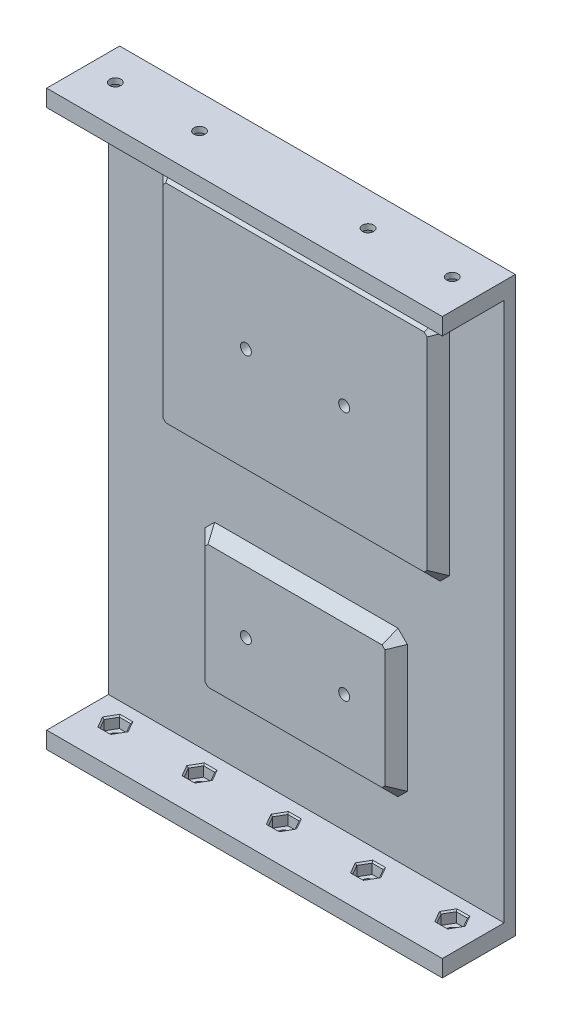
from build123d import *

# Parameters (mm, degrees)
SKETCH1_W               = 140.9
SKETCH1_H               = 204
BOSS_EXTRUDE1_DEPTH     = 4
SKETCH4_W               = 140.9
SKETCH4_H               = 6
BOSS_EXTRUDE3_DEPTH     = 22
CUT_EXTRUDE1_DEPTH      = 217.940550612
CUT_EXTRUDE1_DEPTH_BACK = 217.940550612
SKETCH5_R               = 2
CUT_EXTRUDE4_DEPTH      = 4
SKETCH9_R               = 2
CUT_EXTRUDE5_DEPTH      = 212.308311479
CUT_EXTRUDE6_DEPTH      = 4
CHAMFER1_SIZE           = 0.5
SKETCH11_W              = 64
SKETCH11_H              = 44
SKETCH11_W_2            = 94
SKETCH11_H_2            = 74
BOSS_EXTRUDE4_DEPTH     = 4
CHAMFER2_SIZE           = 1
CHAMFER3_SIZE           = 4
SKETCH12_R              = 1.95
CUT_EXTRUDE7_DEPTH      = 5


with BuildPart() as part:
    # Sketch1 → Boss-Extrude1 (new body)
    with BuildSketch(Plane.XY):
        Rectangle(SKETCH1_W, SKETCH1_H)
    extrude(amount=-BOSS_EXTRUDE1_DEPTH)

    # Sketch4 → Boss-Extrude3 (add)
    with BuildSketch(Plane.XY):
        with Locations((0, 99)):
            Rectangle(SKETCH4_W, SKETCH4_H)
        with Locations((0, -99)):
            Rectangle(SKETCH4_W, SKETCH4_H)
    extrude(amount=BOSS_EXTRUDE3_DEPTH)

    # Sketch5 → Cut-Extrude1 (cut, two sides: drawn at the far end of the back side and taken through both)
    with BuildSketch(Plane(origin=(0, 102, 0), x_dir=(1, 0, 0), z_dir=(0, 1, 0)).offset(-CUT_EXTRUDE1_DEPTH_BACK)):
        with Locations(Location((-30, -8, 0), (0, 0, 270))):
            Circle(SKETCH5_R)
        with Locations(Location((-60, -8, 0), (0, 0, 270))):
            Circle(SKETCH5_R)
        with Locations(Location((60, -8, 0), (0, 0, 90))):
            Circle(SKETCH5_R)
        with Locations(Location((30, -8, 0), (0, 0, 90))):
            Circle(SKETCH5_R)
    extrude(amount=CUT_EXTRUDE1_DEPTH + CUT_EXTRUDE1_DEPTH_BACK, mode=Mode.SUBTRACT)

    # Sketch8 → Cut-Extrude4 (cut)
    with BuildSketch(Plane(origin=(0, -96, 0), x_dir=(1, 0, 0), z_dir=(0, 1, 0))):
        Polygon((-26.016283143, -8), (-28.008141571, -4.55), (-31.991858429, -4.55), (-33.983716857, -8), (-31.991858429, -11.45), (-28.008141571, -11.45), align=None)
        Polygon((-56.016283143, -8), (-58.008141571, -4.55), (-61.991858429, -4.55), (-63.983716857, -8), (-61.991858429, -11.45), (-58.008141571, -11.45), align=None)
        Polygon((33.983716857, -8), (31.991858429, -4.55), (28.008141571, -4.55), (26.016283143, -8), (28.008141571, -11.45), (31.991858429, -11.45), align=None)
        Polygon((63.983716857, -8), (61.991858429, -4.55), (58.008141571, -4.55), (56.016283143, -8), (58.008141571, -11.45), (61.991858429, -11.45), align=None)
    cut_extrude4 = extrude(amount=-CUT_EXTRUDE4_DEPTH, mode=Mode.SUBTRACT)

    # Mirror1: Cut-Extrude4 across plane
    add(cut_extrude4.mirror(Plane.ZX), mode=Mode.SUBTRACT)

    # Sketch9 → Cut-Extrude5 (cut, through all)
    with BuildSketch(Plane(origin=(0, -96, 0), x_dir=(1, 0, 0), z_dir=(0, 1, 0))):
        with Locations(Location((0, -8, 0), (0, 0, 270))):
            Circle(SKETCH9_R)
    extrude(amount=-CUT_EXTRUDE5_DEPTH, mode=Mode.SUBTRACT)

    # Sketch10 → Cut-Extrude6 (cut)
    with BuildSketch(Plane(origin=(0, -96, 0), x_dir=(1, 0, 0), z_dir=(0, 1, 0))):
        Polygon((1.991858429, -4.55), (-1.991858429, -4.55), (-3.983716857, -8), (-1.991858429, -11.45), (1.991858429, -11.45), (3.983716857, -8), align=None)
    extrude(amount=-CUT_EXTRUDE6_DEPTH, mode=Mode.SUBTRACT)

    # Chamfer1
    chamfer1_edges = [part.edges().sort_by_distance(p)[0] for p in [
        (32.987787643, -96, 9.725),
        (32.987787643, -96, 6.275),
        (30, -96, 4.55),
        (27.012212357, -96, 6.275),
        (27.012212357, -96, 9.725),
        (30, -96, 11.45),
        (62.987787643, -96, 9.725),
        (62.987787643, -96, 6.275),
        (60, -96, 4.55),
        (57.012212357, -96, 6.275),
        (57.012212357, -96, 9.725),
        (60, -96, 11.45),
        (-57.012212357, 96, 9.725),
        (-57.012212357, 96, 6.275),
        (-60, 96, 4.55),
        (-62.987787643, 96, 6.275),
        (-62.987787643, 96, 9.725),
        (-60, 96, 11.45),
        (-27.012212357, 96, 9.725),
        (-27.012212357, 96, 6.275),
        (-30, 96, 4.55),
        (-32.987787643, 96, 6.275),
        (-32.987787643, 96, 9.725),
        (-30, 96, 11.45),
        (32.987787643, 96, 9.725),
        (32.987787643, 96, 6.275),
        (30, 96, 4.55),
        (27.012212357, 96, 6.275),
        (27.012212357, 96, 9.725),
        (30, 96, 11.45),
        (62.987787643, 96, 9.725),
        (62.987787643, 96, 6.275),
        (60, 96, 4.55),
        (57.012212357, 96, 6.275),
        (57.012212357, 96, 9.725),
        (60, 96, 11.45),
        (2.987787643, -96, 6.275),
        (0, -96, 4.55),
        (-2.987787643, -96, 6.275),
        (-2.987787643, -96, 9.725),
        (0, -96, 11.45),
        (2.987787643, -96, 9.725),
        (-57.012212357, -96, 9.725),
        (-57.012212357, -96, 6.275),
        (-60, -96, 4.55),
        (-62.987787643, -96, 6.275),
        (-62.987787643, -96, 9.725),
        (-60, -96, 11.45),
        (-27.012212357, -96, 9.725),
        (-27.012212357, -96, 6.275),
        (-30, -96, 4.55),
        (-32.987787643, -96, 6.275),
        (-32.987787643, -96, 9.725),
        (-30, -96, 11.45),
    ]]
    chamfer(chamfer1_edges, length=CHAMFER1_SIZE)

    # Sketch11 → Boss-Extrude4 (add)
    with BuildSketch(Plane.XY):
        with Locations((0, -50)):
            Rectangle(SKETCH11_W, SKETCH11_H)
        with Locations((0, 39)):
            Rectangle(SKETCH11_W_2, SKETCH11_H_2)
    extrude(amount=BOSS_EXTRUDE4_DEPTH)

    # Chamfer2
    chamfer2_edges = [part.edges().sort_by_distance(p)[0] for p in [
        (-32, -28, 2),
        (-32, -72, 2),
        (32, -72, 2),
        (32, -28, 2),
        (-47, 76, 2),
        (-47, 2, 2),
        (47, 2, 2),
        (47, 76, 2),
    ]]
    chamfer(chamfer2_edges, length=CHAMFER2_SIZE)

    # Chamfer3
    chamfer3_edges = [part.edges().sort_by_distance(p)[0] for p in [
        (-46.5, 2.5, 0),
        (0, 2, 0),
        (46.5, 2.5, 0),
        (47, 39, 0),
        (46.5, 75.5, 0),
        (0, 76, 0),
        (-46.5, 75.5, 0),
        (-47, 39, 0),
        (-31.5, -71.5, 0),
        (0, -72, 0),
        (31.5, -71.5, 0),
        (32, -50, 0),
        (31.5, -28.5, 0),
        (0, -28, 0),
        (-31.5, -28.5, 0),
        (-32, -50, 0),
    ]]
    chamfer(chamfer3_edges, length=CHAMFER3_SIZE - 0.0001)  # a hair under: the kernel refuses the full size

    # Sketch12 → Cut-Extrude7 (cut)
    with BuildSketch(Plane.XY.offset(4)):
        with Locations((-17.5, 39)):
            Circle(SKETCH12_R)
        with Locations((17.5, 39)):
            Circle(SKETCH12_R)
        with Locations((-17.5, -50)):
            Circle(SKETCH12_R)
        with Locations((17.5, -50)):
            Circle(SKETCH12_R)
    extrude(amount=-CUT_EXTRUDE7_DEPTH, mode=Mode.SUBTRACT)


solid = part.part
